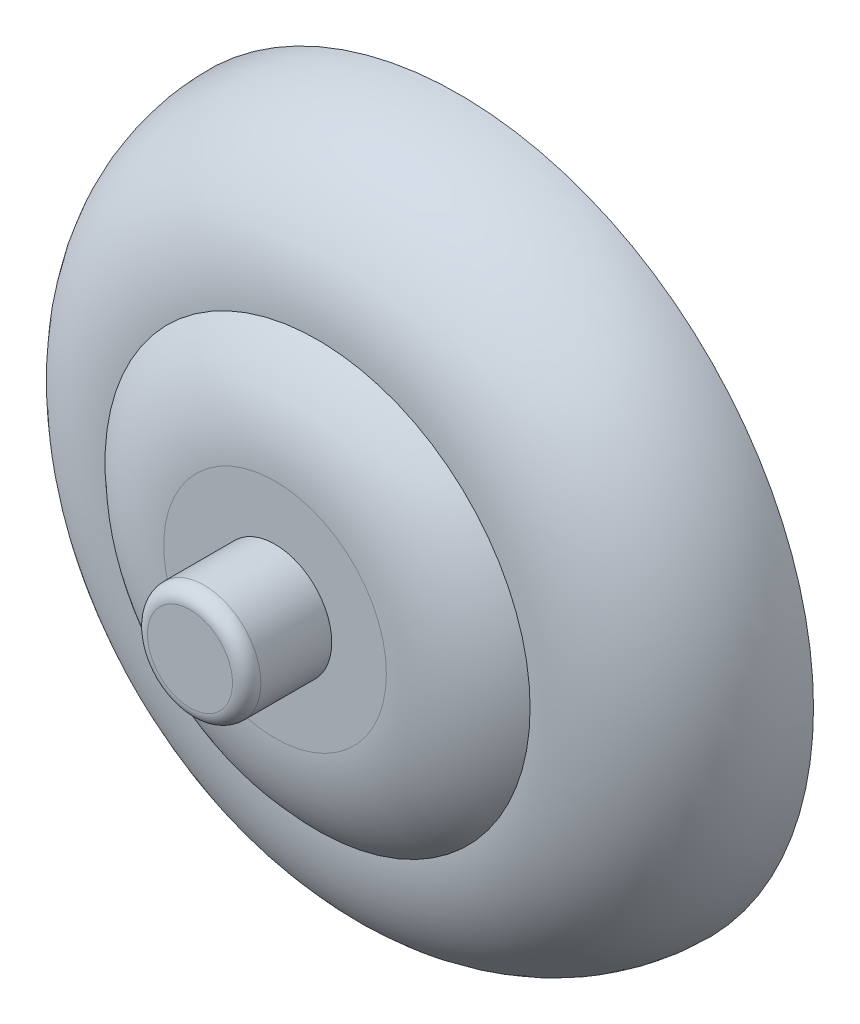
from build123d import *

# Parameters (mm, degrees)
ESQUISSE1_R        = 25
BOSS_EXTRU_1_DEPTH = 10
ESQUISSE2_R        = 15
BOSS_EXTRU_2_DEPTH = 3
ESQUISSE3_R        = 4
BOSS_EXTRU_3_DEPTH = 6
CONG_1_R           = 10
CONG_2_R           = 1
CONG_3_R           = 10


# Some blends are built 0.0001 mm under size
with BuildPart() as part:
    # Esquisse1 → Boss.-Extru.1 (new body)
    with BuildSketch(Plane.XY):
        Circle(ESQUISSE1_R)
    extrude(amount=BOSS_EXTRU_1_DEPTH)

    # Esquisse2 → Boss.-Extru.2 (add)
    with BuildSketch(Plane.XY.offset(10)):
        Circle(ESQUISSE2_R)
    extrude(amount=BOSS_EXTRU_2_DEPTH)

    # Esquisse3 → Boss.-Extru.3 (add)
    with BuildSketch(Plane.XY.offset(13)):
        Circle(ESQUISSE3_R)
    extrude(amount=BOSS_EXTRU_3_DEPTH)

    # Congé1
    # the kernel refuses this fillet: 10 mm, written as the material it takes off along each edge
    with BuildSketch(Plane(origin=(0, 0, 13), x_dir=(1, 0, 0), z_dir=(0, -1, 0))) as cong_1_piece_1:
        with BuildLine():
            CenterArc((7.858571571, -10), CONG_1_R, 44.427004001, 45.572995999)
            Line((7.858571571, 0), (7.858571571, 0.2))
            Line((7.858571571, 0.2), (15, 0.2))
            Line((15, 0.2), (15.2, 0))
            ThreePointArc((15.2, 0), (15.2, -1.5), (15.142828569, -2.86))
            Line((15.142828569, -2.86), (15, -3))
        make_face()
    revolve(axis=Axis((0, 0, 13), (0, 0, 1)), mode=Mode.SUBTRACT)

    # Congé2
    cong_2_edges = [part.edges().sort_by_distance(p)[0] for p in [
        (-4, 0, 19),
    ]]
    fillet(cong_2_edges, radius=CONG_2_R)

    # Congé3
    cong_3_edges = [part.edges().sort_by_distance(p)[0] for p in [
        (-25, 0, 10),
    ]]
    fillet(cong_3_edges, radius=CONG_3_R - 0.0001)  # a hair under: the kernel refuses the full size


solid = part.part
